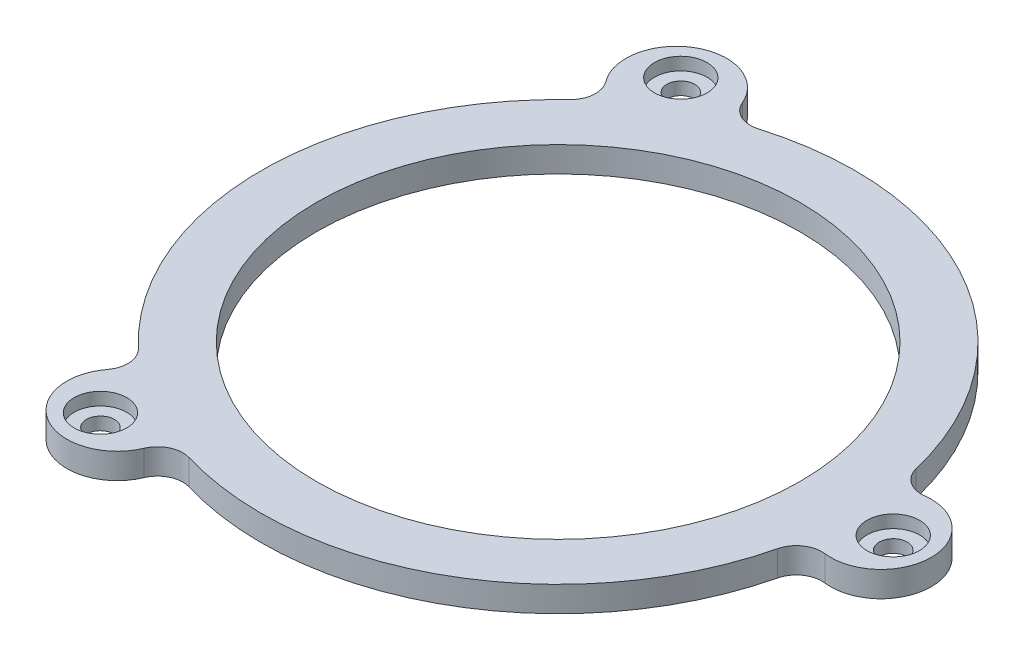
from build123d import *

# Parameters (mm, degrees)
SKETCH1_R           = 35
SKETCH1_R_2         = 28.5
BOSS_EXTRUDE1_DEPTH = 3
BOSS_EXTRUDE2_START = -3
BOSS_EXTRUDE2_DEPTH = 3
SKETCH6_R           = 1.65
CUT_EXTRUDE2_DEPTH  = 10
SKETCH7_R           = 3.1
CUT_EXTRUDE3_DEPTH  = 1.5
FILLET1_R           = 3


with BuildPart() as part:
    # Sketch1 → Boss-Extrude1 (new body)
    with BuildSketch(Plane(origin=(0, 0, 0), x_dir=(1, 0, 0), z_dir=(0, 1, 0))):
        Circle(SKETCH1_R)
        Circle(SKETCH1_R_2, mode=Mode.SUBTRACT)
    extrude(amount=BOSS_EXTRUDE1_DEPTH)

    # Sketch3 → Boss-Extrude2 (add)
    with BuildSketch(Plane(origin=(0, 3, 0), x_dir=(1, 0, 0), z_dir=(0, 1, 0)).offset(BOSS_EXTRUDE2_START)):
        with BuildLine():
            ThreePointArc((34.659382406, 4.871058534), (43.989528145, 0), (34.659382406, -4.871058534))
            ThreePointArc((34.659382406, -4.871058534), (35, 0), (34.659382406, 4.871058534))
        make_face()
        with BuildLine():
            ThreePointArc((-13.11123077, -32.45143491), (-21.994764073, -38.096048874), (-21.548151636, -27.580376376))
            ThreePointArc((-21.548151636, -27.580376376), (-17.5, -30.310889132), (-13.11123077, -32.45143491))
        make_face()
        with BuildLine():
            ThreePointArc((-21.548151636, 27.580376376), (-21.994764073, 38.096048874), (-13.11123077, 32.45143491))
            ThreePointArc((-13.11123077, 32.45143491), (-17.5, 30.310889132), (-21.548151636, 27.580376376))
        make_face()
    extrude(amount=BOSS_EXTRUDE2_DEPTH)

    # Sketch6 → Cut-Extrude2 (cut)
    with BuildSketch(Plane(origin=(0, 3, 0), x_dir=(1, 0, 0), z_dir=(0, 1, 0))):
        with Locations((39.5, 0)):
            Circle(SKETCH6_R)
        with Locations((-19.75, -34.208003449)):
            Circle(SKETCH6_R)
        with Locations((-19.75, 34.208003449)):
            Circle(SKETCH6_R)
    extrude(amount=-CUT_EXTRUDE2_DEPTH, mode=Mode.SUBTRACT)

    # Sketch7 → Cut-Extrude3 (cut)
    with BuildSketch(Plane(origin=(0, 3, 0), x_dir=(1, 0, 0), z_dir=(0, 1, 0))):
        with Locations((39.5, 0)):
            Circle(SKETCH7_R)
        with Locations((-19.75, -34.208003449)):
            Circle(SKETCH7_R)
        with Locations((-19.75, 34.208003449)):
            Circle(SKETCH7_R)
    extrude(amount=-CUT_EXTRUDE3_DEPTH, mode=Mode.SUBTRACT)

    # Fillet1
    fillet1_edges = [part.edges().sort_by_distance(p)[0] for p in [
        (34.659382406, 1.5, 4.871058534),
        (-13.11123077, 1.5, 32.45143491),
        (-21.548151636, 1.5, 27.580376376),
        (-21.548151636, 1.5, -27.580376376),
        (-13.11123077, 1.5, -32.45143491),
        (34.659382406, 1.5, -4.871058534),
    ]]
    fillet(fillet1_edges, radius=FILLET1_R)


solid = part.part
